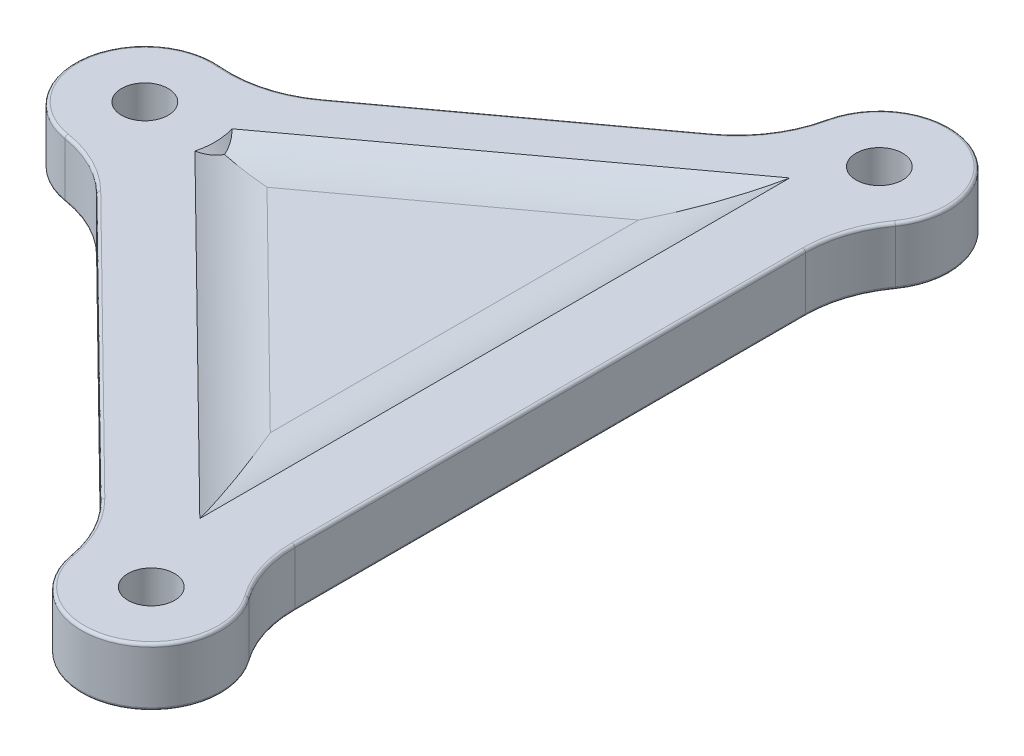
from build123d import *

# Parameters (mm, degrees)
BOSS_EXTRUDE1_DEPTH = 2.5
SKETCH6_R           = 2
CUT_EXTRUDE2_DEPTH  = 81.683428275
FILLET1_R           = 10
FILLET2_R           = 0.25
CUT_EXTRUDE3_DEPTH  = 1
CUT_EXTRUDE3_DRAFT  = -45
FILLET3_R           = 10


# Read off the part's stored shape, not the designer's step: Mirror1
with BuildPart() as part:
    # Sketch5 → Boss-Extrude1 (new, symmetric)
    with BuildSketch(Plane(origin=(0, 0, 0), x_dir=(1, 0, 0), z_dir=(0, 1, 0))):
        with BuildLine():
            Line((-32.965704319, 40.746204167), (-5.742345952, 60.760614197))
            ThreePointArc((-5.742345952, 60.760614197), (2.206223968, 68.07965732), (3, 57.303847577))
            Line((3, 57.303847577), (3, 5.196152423))
            ThreePointArc((3, 5.196152423), (2.317397773, -5.534407607), (-5.807325554, 1.508300339))
            Line((-5.807325554, 1.508300339), (-34.741264584, 30.00061646))
            ThreePointArc((-34.741264584, 30.00061646), (-42.258431929, 36.762212041), (-32.965704319, 40.746204167))
        make_face()
    extrude(amount=BOSS_EXTRUDE1_DEPTH, both=True)

    # Sketch6 → Cut-Extrude2 (cut, through all)
    with BuildSketch(Plane(origin=(0, 2.5, 0), x_dir=(1, 0, 0), z_dir=(0, 1, 0))):
        with Locations(Location((-36.338700951, 35.784058087, 0), (0, 0, 270))):
            Circle(SKETCH6_R)
        with Locations(Location((0, 62.5, 0), (0, 0, 270))):
            Circle(SKETCH6_R)
        with Locations(Location((0, 0, 0), (0, 0, 270))):
            Circle(SKETCH6_R)
    extrude(amount=-CUT_EXTRUDE2_DEPTH, mode=Mode.SUBTRACT)

    # Fillet1
    fillet1_edges = [part.edges().sort_by_distance(p)[0] for p in [
        (3, 0, -57.303847577),
        (3, 0, -5.196152423),
        (-5.807325554, 0, -1.508300339),
        (-34.741264584, 0, -30.00061646),
        (-32.965704319, 0, -40.746204167),
        (-5.742345952, 0, -60.760614197),
    ]]
    fillet(fillet1_edges, radius=FILLET1_R)

    # Fillet2
    fillet2_edges = [part.edges().sort_by_distance(p)[0] for p in [
        (2.317397773, -2.5, 5.534407607),
        (2.317397773, 2.5, 5.534407607),
        (-20.274295069, -2.5, -15.754458399),
        (-20.274295069, 2.5, -15.754458399),
        (-42.294061571, -2.5, -36.514592059),
        (-42.294061571, 2.5, -36.514592059),
        (-19.354025135, -2.5, -50.753409182),
        (-19.354025135, 2.5, -50.753409182),
        (2.436899667, -2.5, -67.982838682),
        (2.436899667, 2.5, -67.982838682),
        (3, -2.5, -31.25),
        (3, 2.5, -31.25),
        (-6.906263042, -2.5, -1.916404592),
        (-6.906263042, 2.5, -1.916404592),
        (-34.316307366, -2.5, -28.908085432),
        (-34.316307366, 2.5, -28.908085432),
        (-32.227862875, -2.5, -42.090278775),
        (-32.227862875, 2.5, -42.090278775),
        (-7.245317265, -2.5, -60.457259979),
        (-7.245317265, 2.5, -60.457259979),
        (3.480283618, -2.5, -56.234483125),
        (3.480283618, 2.5, -56.234483125),
        (3.480283618, -2.5, -6.265516875),
        (3.480283618, 2.5, -6.265516875),
    ]]
    fillet(fillet2_edges, radius=FILLET2_R)


with BuildPart() as cut_extrude3_tool:
    # Sketch11 → Cut-Extrude3 (with draft: the straight prism first)
    with BuildSketch(Plane(origin=(0, 2.5, 0), x_dir=(1, 0, 0), z_dir=(0, 1, 0))):
        with BuildLine():
            ThreePointArc((-30.596355, 37.52344389), (-30.339901547, 35.904081877), (-30.531375397, 34.275757748))
            Line((-30.531375397, 34.275757748), (-3, 7.164597728))
            Line((-3, 7.164597728), (-3, 57.812078262))
            Line((-3, 57.812078262), (-30.596355, 37.52344389))
        make_face()
    extrude(amount=-CUT_EXTRUDE3_DEPTH)
    # Cut-Extrude3: the draft: its side faces are tilted about the plane it starts from
    cut_extrude3_sides = [cut_extrude3_tool.faces().sort_by_distance(p)[0] for p in [
        (-30.339901547, 2, -35.904081877),
        (-16.765687699, 2, -20.720177738),
        (-3, 2, -32.488337995),
        (-16.7981775, 2, -47.667761076),
    ]]
    draft(cut_extrude3_sides, Plane(origin=(0, 2.5, 0), x_dir=(1, 0, 0), z_dir=(0, 1, 0)), CUT_EXTRUDE3_DRAFT)


with BuildPart() as part_1:
    add(part.part)

    # Cut-Extrude3: cut by cut_extrude3_tool
    add(cut_extrude3_tool.part, mode=Mode.SUBTRACT)

    # Fillet3
    # the kernel refuses this fillet: 10 mm, written as the material it adds along each edge
    with BuildSketch(Plane(origin=(-35.422208483, 1.5, -40.495403727), x_dir=(-0.4961401986594238, 0.7071067811865456, 0.5038302325924777), z_dir=(0.712523548065871, 0, 0.701648197782637))) as fillet3_piece_1_section:
        with BuildLine():
            CenterArc((4.695967592, -9.446168032), FILLET3_R, 109.158067237, 25.841932763)
            Line((-2.37510022, -2.37510022), (0, 0))
            Line((0, 0), (1.414213562, 0))
        make_face()
    fillet3_piece_1 = extrude(amount=52.497135101, mode=Mode.PRIVATE)
    fillet3_piece_1 = split(fillet3_piece_1, bisect_by=Plane(origin=(-21.679167278, -8.239532903, -30.749685658), z_dir=(0.4188457426606433, 0.7071067811865488, 0.5697089115110034)), keep=Keep.TOP, mode=Mode.PRIVATE)
    fillet3_piece_1 = split(fillet3_piece_1, bisect_by=Plane(origin=(-9.768964958, -4.268964958, -22.714341228), z_dir=(-0.7071067811865462, 0.7071067811865488, 0)), keep=Keep.TOP, mode=Mode.PRIVATE)
    add(fillet3_piece_1)
    with BuildSketch(Plane(origin=(2.765578806, 1.5, -60.809716743), x_dir=(-0.4188457426606457, 0.7071067811865447, -0.5697089115110068), z_dir=(-0.805690069263676, 0, 0.5923373298129141))) as fillet3_piece_2_section:
        with BuildLine():
            CenterArc((4.695967592, -9.446168032), FILLET3_R, 109.158067237, 25.841932763)
            Line((-2.37510022, -2.37510022), (0, 0))
            Line((0, 0), (1.414213562, 0))
        make_face()
    fillet3_piece_2 = extrude(amount=48.40225373, mode=Mode.PRIVATE)
    fillet3_piece_2 = split(fillet3_piece_2, bisect_by=Plane(origin=(-9.835247725, -4.335247725, -45.695753356), z_dir=(-0.7071067811865462, 0.7071067811865488, 0)), keep=Keep.TOP, mode=Mode.PRIVATE)
    add(fillet3_piece_2)
    with BuildSketch(Plane(origin=(-4, 1.5, -1.155549611), x_dir=(0.7071067811865488, 0.7071067811865462, 0), z_dir=(0, 0, -1))) as fillet3_piece_3_section:
        with BuildLine():
            CenterArc((4.695967592, -9.446168032), FILLET3_R, 109.158067237, 25.841932763)
            Line((-2.37510022, -2.37510022), (0, 0))
            Line((0, 0), (1.414213562, 0))
        make_face()
    fillet3_piece_3 = extrude(amount=63.077411412, mode=Mode.PRIVATE)
    fillet3_piece_3 = split(fillet3_piece_3, bisect_by=Plane(origin=(-10.603901171, -7.527129797, -39.776353526), z_dir=(0.4188457426606433, 0.7071067811865488, 0.5697089115110034)), keep=Keep.TOP, mode=Mode.PRIVATE)
    fillet3_piece_3 = split(fillet3_piece_3, bisect_by=Plane(origin=(-10.614934948, -6.100094299, -26.733213697), z_dir=(0.49614019865942166, 0.7071067811865488, -0.5038302325924754)), keep=Keep.TOP, mode=Mode.PRIVATE)
    add(fillet3_piece_3)

    # Mirror1
    split(bisect_by=Plane.ZX, keep=Keep.TOP)

    # Mirror1 2: part across plane


with BuildPart() as part_2:
    add(part_1.part)
    add(part_1.part.mirror(Plane.ZX))


solid = part_2.part
